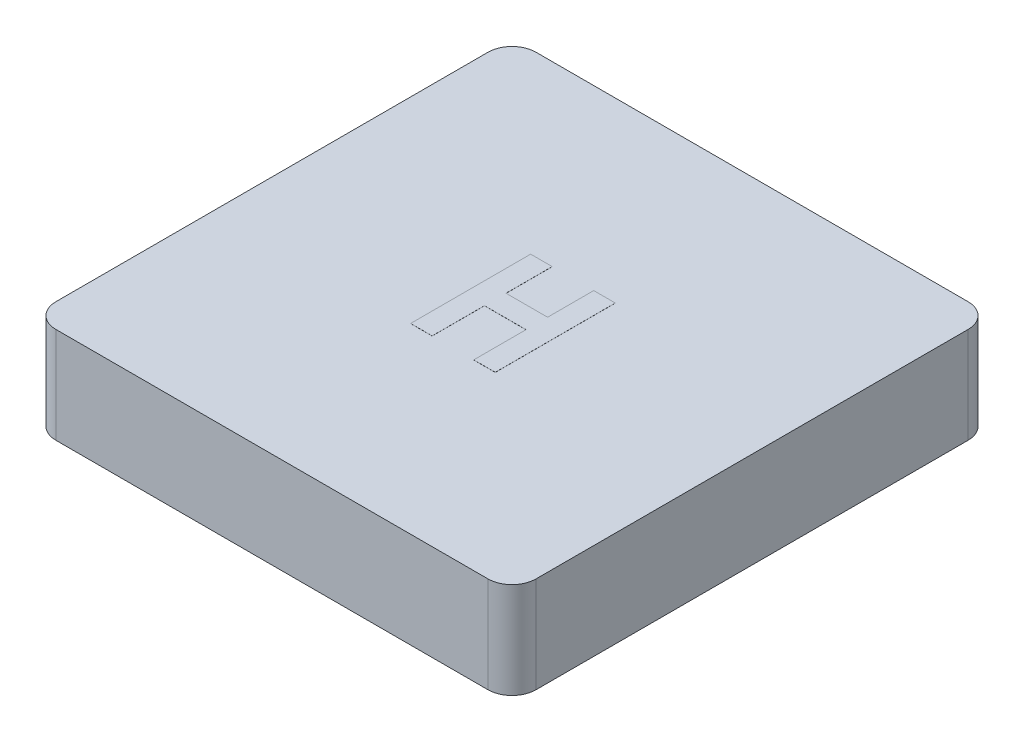
from build123d import *

# Parameters (mm, degrees)
SKETCH1_W           = 12.7
SKETCH1_H           = 12.7
BOSS_EXTRUDE1_DEPTH = 2.54
FILLET1_R           = 0.635
SHELL1_START        = 0.635
SHELL1_OUTLINE_W    = 1.905
SHELL1_OUTLINE_H    = 11.43
SHELL1_DEPTH        = 11.43
SKETCH2_R           = 2.54
BOSS_EXTRUDE2_DEPTH = 1.905
BOSS_EXTRUDE3_DEPTH = 0.00254


# Read off the part's stored shape, not the designer's step: Shell1
with BuildPart() as part:
    # Sketch1 → Boss-Extrude1 (new body)
    with BuildSketch(Plane(origin=(0, 0, 0), x_dir=(1, 0, 0), z_dir=(0, 1, 0))):
        with Locations((6.35, 6.35)):
            Rectangle(SKETCH1_W, SKETCH1_H)
    extrude(amount=BOSS_EXTRUDE1_DEPTH)

    # Fillet1
    fillet1_edges = [part.edges().sort_by_distance(p)[0] for p in [
        (0, 1.27, -12.7),
        (12.7, 1.27, -12.7),
        (12.7, 1.27, 0),
        (0, 1.27, 0),
    ]]
    fillet(fillet1_edges, radius=FILLET1_R)

    # Shell1 outline → Shell1 (cut)
    with BuildSketch(Plane.YZ.offset(SHELL1_START)):
        with Locations((0.9525, -6.35)):
            Rectangle(SHELL1_OUTLINE_W, SHELL1_OUTLINE_H)
    extrude(amount=SHELL1_DEPTH, mode=Mode.SUBTRACT)

    # Sketch2 → Boss-Extrude2 (add)
    with BuildSketch(Plane(origin=(0, 1.905, 0), x_dir=(-1, 0, 0), z_dir=(0, -1, 0))):
        with Locations(Location((-6.35, 6.35, 0), (0, 0, 270))):
            Circle(SKETCH2_R)
    extrude(amount=BOSS_EXTRUDE2_DEPTH)

    # Sketch3 → Boss-Extrude3 (add)
    with BuildSketch(Plane(origin=(0, 2.54, 0), x_dir=(1, 0, 0), z_dir=(0, 1, 0))):
        Polygon((5.192346154, 8.001), (5.762217949, 8.001), (5.762217949, 6.779846154), (6.86125641, 6.779846154), (6.86125641, 8.001), (7.431128205, 8.001), (7.431128205, 4.826), (6.86125641, 4.826), (6.86125641, 6.209974359), (5.762217949, 6.209974359), (5.762217949, 4.826), (5.192346154, 4.826), align=None)
    extrude(amount=BOSS_EXTRUDE3_DEPTH)


solid = part.part
